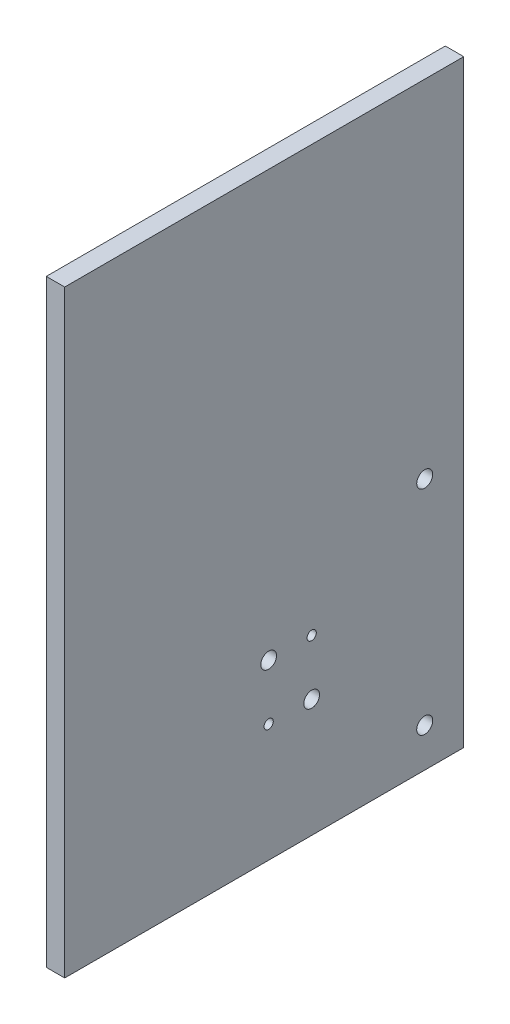
from build123d import *

# Parameters (mm, degrees)
SKETCH1_R           = 1.5
SKETCH1_R_2         = 2.555
SKETCH1_R_3         = 2.6
BOSS_EXTRUDE1_DEPTH = 6


with BuildPart() as part:
    # Sketch1 → Boss-Extrude1 (new body)
    with BuildSketch(Plane.YZ):
        Polygon((-47.4, -25), (-47.4, -56.5), (47.4, -56.5), (147.4, -56.5), (147.4, 16), (147.4, 73.4), (-47.4, 73.4), (-47.4, 16), align=None)
        with Locations((-9, 7)):
            Circle(SKETCH1_R, mode=Mode.SUBTRACT)
        with Locations((-9, -7)):
            Circle(SKETCH1_R_2, mode=Mode.SUBTRACT)
        with Locations((9, -7)):
            Circle(SKETCH1_R, mode=Mode.SUBTRACT)
        with Locations((9, 7)):
            Circle(SKETCH1_R_2, mode=Mode.SUBTRACT)
        with Locations((-34.7, -43.8)):
            Circle(SKETCH1_R_3, mode=Mode.SUBTRACT)
        with Locations((34.7, -43.8)):
            Circle(SKETCH1_R_3, mode=Mode.SUBTRACT)
    extrude(amount=BOSS_EXTRUDE1_DEPTH)


solid = part.part
